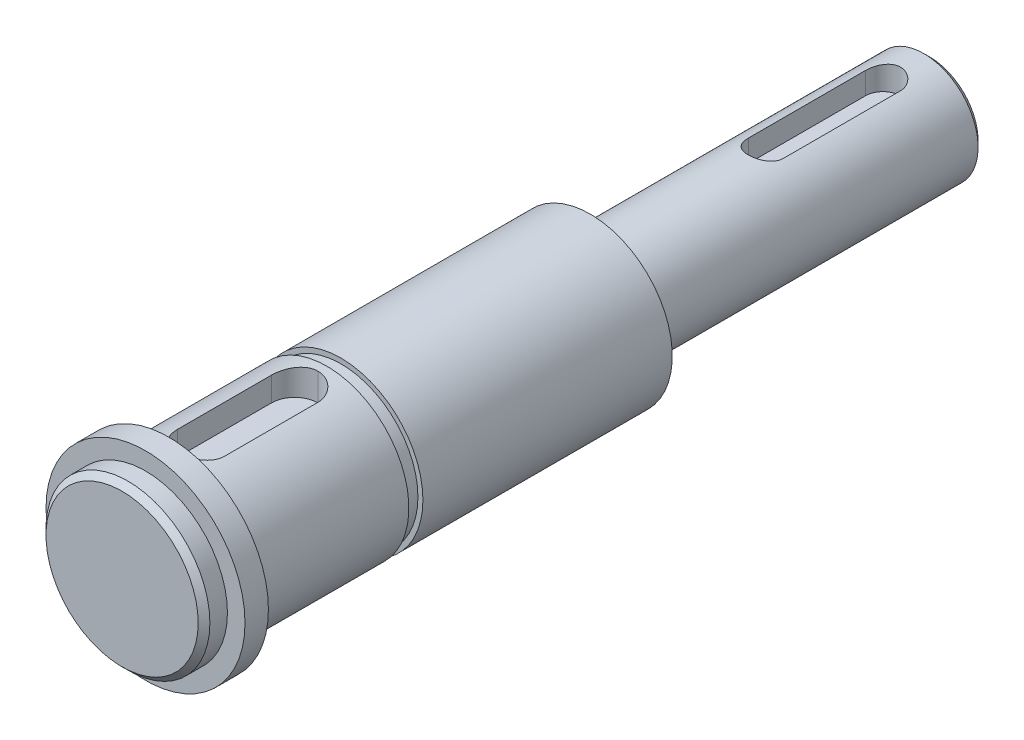
from build123d import *

# Parameters (mm, degrees)
BOSS_EXTRUDE1_DEPTH      = 5
BOSS_EXTRUDE1_DEPTH_BACK = 100
SKETCH1_R                = 14
SKETCH2_W                = 8
SKETCH2_H                = 24
CUT_EXTRUDE1_DEPTH       = 8
SKETCH3_R                = 14
BOSS_EXTRUDE2_DEPTH      = 8
FILLET1_R                = 4
SKETCH4_W                = 4
SKETCH4_H                = 3
SKETCH7_W                = 6.85
SKETCH7_H                = 2.4
CUT_EXTRUDE2_START       = -5
SKETCH8_R                = 14
CUT_EXTRUDE2_DEPTH       = 5
SKETCH9_R                = 21.936925755
SKETCH9_R_2              = 9.25
CUT_EXTRUDE3_DEPTH       = 28
BOSS_EXTRUDE3_START      = 30
SKETCH10_R               = 9.25
BOSS_EXTRUDE3_DEPTH      = 30
CHAMFER1_SIZE            = 1
CUT_EXTRUDE4_START       = 5
CUT_EXTRUDE4_DEPTH       = 10


with BuildPart() as part:
    # Sketch1 → Boss-Extrude1 (new, two sides: drawn at the far end of the back side and taken through both)
    with BuildSketch(Plane.XY.offset(-BOSS_EXTRUDE1_DEPTH_BACK)):
        Circle(SKETCH1_R)
    extrude(amount=BOSS_EXTRUDE1_DEPTH + BOSS_EXTRUDE1_DEPTH_BACK)

    # Sketch2 → Cut-Extrude1 (cut)
    with BuildSketch(Plane.XZ.offset(-17.3)):
        with Locations((0, -13.5)):
            Rectangle(SKETCH2_W, SKETCH2_H)
    extrude(amount=CUT_EXTRUDE1_DEPTH, mode=Mode.SUBTRACT)

    # Sketch3 → Boss-Extrude2 (add)
    with BuildSketch(Plane.XY.offset(5)):
        Circle(SKETCH3_R)
    extrude(amount=BOSS_EXTRUDE2_DEPTH)

    # Fillet1
    fillet1_edges = [part.edges().sort_by_distance(p)[0] for p in [
        (-4, 11.358203932, -25.5),
        (4, 11.358203932, -25.5),
        (4, 11.358203932, -1.5),
        (-4, 11.358203932, -1.5),
    ]]
    fillet(fillet1_edges, radius=FILLET1_R - 0.0001)  # a hair under: the kernel refuses the full size

    # Sketch4 → Revolve1 (revolve)
    with BuildSketch(Plane(origin=(0, 0, 0), x_dir=(0, 0, -1), z_dir=(1, 0, 0)), mode=Mode.PRIVATE) as revolve1_sk:
        with Locations((-2, -15.5)):
            Rectangle(SKETCH4_W, SKETCH4_H)
    revolve(revolve1_sk.sketch.rotate(Axis((0, 0, 0), (0, 0, -1)), 270), axis=Axis((0, 0, 0), (0, 0, -1)))

    # Sketch7 → Cut-Revolve2 (revolve, cut)
    with BuildSketch(Plane(origin=(0, 0, 0), x_dir=(1, 0, 0), z_dir=(0, 1, 0)), mode=Mode.PRIVATE) as cut_revolve2_sk:
        with Locations((-16.575, 28.197290459)):
            Rectangle(SKETCH7_W, SKETCH7_H)
    revolve(cut_revolve2_sk.sketch.rotate(Axis((0, 0, 5), (0, 0, -1)), 180), axis=Axis((0, 0, 5), (0, 0, -1)), mode=Mode.SUBTRACT)

    # Sketch8 → Cut-Extrude2 (cut)
    with BuildSketch(Plane.XY.offset(13).offset(CUT_EXTRUDE2_START)):
        Circle(SKETCH8_R)
    extrude(amount=CUT_EXTRUDE2_DEPTH, mode=Mode.SUBTRACT)

    # Sketch9 → Cut-Extrude3 (cut)
    with BuildSketch(Plane(origin=(0, 0, -100), x_dir=(-1, 0, 0), z_dir=(0, 0, -1))):
        Circle(SKETCH9_R)
        Circle(SKETCH9_R_2, mode=Mode.SUBTRACT)
    extrude(amount=-CUT_EXTRUDE3_DEPTH, mode=Mode.SUBTRACT)

    # Sketch10 → Boss-Extrude3 (add)
    with BuildSketch(Plane(origin=(0, 0, -100), x_dir=(-1, 0, 0), z_dir=(0, 0, -1)).offset(BOSS_EXTRUDE3_START)):
        Circle(SKETCH10_R)
    extrude(amount=-BOSS_EXTRUDE3_DEPTH)

    # Chamfer1
    chamfer1_edges = [part.edges().sort_by_distance(p)[0] for p in [
        (9.25, 0, -130),
        (-14, 0, 8),
    ]]
    chamfer(chamfer1_edges, length=CHAMFER1_SIZE)

    # Sketch15 → Cut-Extrude4 (cut)
    with BuildSketch(Plane(origin=(0, 0, 0), x_dir=(1, 0, 0), z_dir=(0, 1, 0)).offset(CUT_EXTRUDE4_START)):
        with BuildLine():
            Line((3, 122), (3, 102))
            ThreePointArc((3, 102), (0, 99), (-3, 102))
            Line((-3, 102), (-3, 122))
            ThreePointArc((-3, 122), (0, 125), (3, 122))
        make_face()
    extrude(amount=CUT_EXTRUDE4_DEPTH, mode=Mode.SUBTRACT)


solid = part.part
